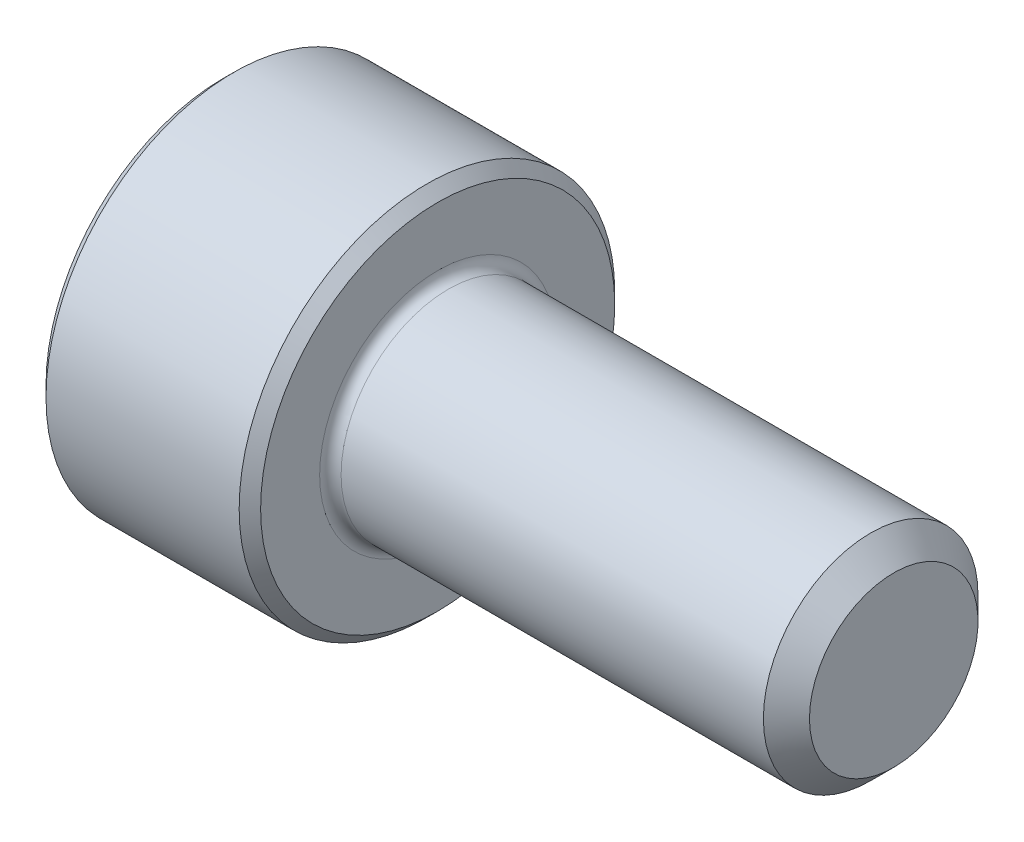
from build123d import *

# Parameters (mm, degrees)
CUT_EXTRUDE_1_DEPTH = 2


with BuildPart() as part:
    # 草图1 → 旋转1 (revolve)
    with BuildSketch(Plane.XY):
        with BuildLine():
            Line((0, 0), (0, 3.3))
            Line((0, 3.3), (0.2, 3.5))
            Line((0.2, 3.5), (3.8, 3.5))
            Line((3.8, 3.5), (4, 3.3))
            Line((4, 3.3), (4, 2.2))
            ThreePointArc((4, 2.2), (4.058578644, 2.058578644), (4.2, 2))
            Line((4.2, 2), (12.0705, 2))
            Line((12.0705, 2), (12.5, 1.5705))
            Line((12.5, 1.5705), (12.5, 0))
            Line((12.5, 0), (0, 0))
        make_face()
    revolve(axis=Axis((12.5, 0, 0), (-1, 0, 0)))

    # 草图2 → 切除-拉伸1 (cut)
    with BuildSketch(Plane(origin=(0, 0, 0), x_dir=(0, 0, -1), z_dir=(1, 0, 0))):
        Polygon((-1.5, 0.866025404), (-1.5, -0.866025404), (0, -1.732050808), (1.5, -0.866025404), (1.5, 0.866025404), (0, 1.732050808), align=None)
    extrude(amount=CUT_EXTRUDE_1_DEPTH, mode=Mode.SUBTRACT)


solid = part.part
